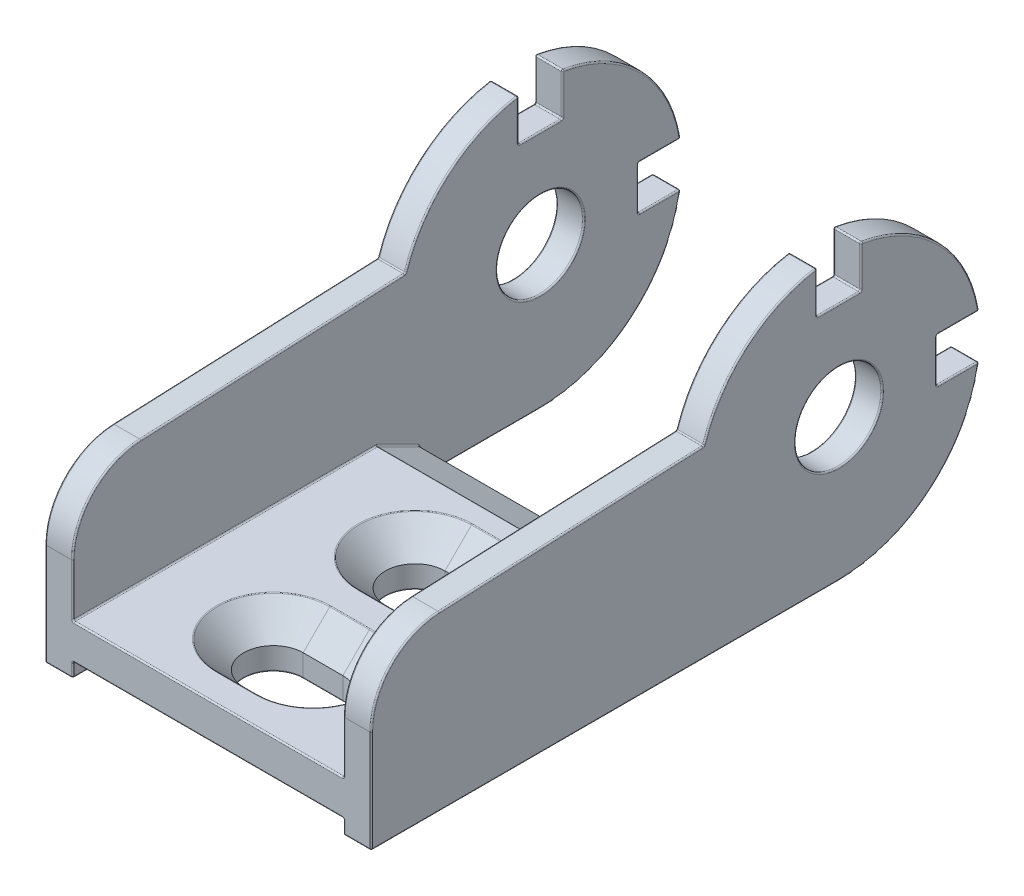
from build123d import *

# Parameters (mm, degrees)
BODY_DEPTH                       = 33
BODY_DEPTH_BACK                  = 10
PIVOT_HOLE_DEPTH                 = 37.349002737
PIVOT_HOLE_DEPTH_BACK            = 37.349002737
PIVOT_HOLE_SKETCH_R              = 3.05
OUTSIDE_SHAPE_CUT_OUT_DEPTH      = 37.349002737
OUTSIDE_SHAPE_CUT_OUT_DEPTH_BACK = 37.349002737
OUTSIDE_SHAPE_CUT_OUT_SKETCH_W   = 45
OUTSIDE_SHAPE_CUT_OUT_SKETCH_H   = 22
INSIDE_SHAPE_CUT_OUT_DEPTH       = 9.55
LIGHTENING_SKETCH_W              = 8
LIGHTENING_SKETCH_H              = 4
LIGHTENING_DEPTH                 = 0.5
M4_START                         = -10
M4_4_2X7_DEPTH                   = 3.5
F_15_15_BF_1PZ_W                 = 0.181818182
F_15_15_BF_1PZ_H                 = 0.285714286
F_15_15_BF_1PZ_W_2               = 0.181818181
TEXT_2_DEPTH                     = 0.05
PRODUCTION_FILLET_R              = 0.1


with BuildPart() as part:
    # Profile Sketch → Body (new, two sides: drawn at the far end of the back side and taken through both)
    with BuildSketch(Plane.XY.offset(-BODY_DEPTH_BACK)):
        Polygon((-11.5, -10), (11.5, -10), (11.5, 10), (9.55, 10), (9.55, -6.5), (-9.55, -6.5), (-9.55, 10), (-11.5, 10), align=None)
    extrude(amount=BODY_DEPTH + BODY_DEPTH_BACK)

    # Pivot Hole Sketch → Pivot Hole (cut, two sides: drawn at the far end of the back side and taken through both)
    with BuildSketch(Plane(origin=(0, 0, 0), x_dir=(0, 0, -1), z_dir=(1, 0, 0)).offset(-PIVOT_HOLE_DEPTH_BACK)):
        Circle(PIVOT_HOLE_SKETCH_R)
    extrude(amount=PIVOT_HOLE_DEPTH + PIVOT_HOLE_DEPTH_BACK, mode=Mode.SUBTRACT)

    # Outside Shape Cut Out Sketch → Outside Shape Cut Out (cut, two sides: drawn at the far end of the back side and taken through both)
    with BuildSketch(Plane(origin=(0, 0, 0), x_dir=(0, 0, -1), z_dir=(1, 0, 0)).offset(-OUTSIDE_SHAPE_CUT_OUT_DEPTH_BACK)):
        with Locations((-12.5, -1)):
            Rectangle(OUTSIDE_SHAPE_CUT_OUT_SKETCH_W, OUTSIDE_SHAPE_CUT_OUT_SKETCH_H)
        with BuildLine():
            Line((-28.212929862, 2.204047147), (-9.539392014, 3))
            ThreePointArc((-9.539392014, 3), (-6.524899368, 7.577973887), (-1.55, 9.8791447))
            Line((-1.55, 9.8791447), (-1.55, 6.9))
            Line((-1.55, 6.9), (1.55, 6.9))
            Line((1.55, 6.9), (1.55, 9.8791447))
            ThreePointArc((1.55, 9.8791447), (7.071067812, 7.071067812), (9.8791447, 1.55))
            Line((9.8791447, 1.55), (6.9, 1.55))
            Line((6.9, 1.55), (6.9, -1.55))
            Line((6.9, -1.55), (9.8791447, -1.55))
            ThreePointArc((9.8791447, -1.55), (6.5, -7.599342077), (0, -10))
            Line((0, -10), (-33, -10))
            Line((-33, -10), (-33, -2.791416882))
            ThreePointArc((-33, -2.791416882), (-31.610031116, 0.668015924), (-28.212929862, 2.204047147))
        make_face(mode=Mode.SUBTRACT)
    extrude(amount=OUTSIDE_SHAPE_CUT_OUT_DEPTH + OUTSIDE_SHAPE_CUT_OUT_DEPTH_BACK, mode=Mode.SUBTRACT)

    # Inside Shape Cut Out Sketch → Inside Shape Cut Out (cut, symmetric)
    with BuildSketch(Plane(origin=(0, 0, 0), x_dir=(0, 0, -1), z_dir=(1, 0, 0))):
        Polygon((-30, -8), (-30, -10), (-33, -10), (-33, -9), (-31.5, -9), (-31.5, -8), align=None)
        Polygon((-11.6, -6.5), (-8.6, -8), (-8.6, -10), (7.599342077, -10), (7.599342077, -6.5), align=None)
    extrude(amount=INSIDE_SHAPE_CUT_OUT_DEPTH, both=True, mode=Mode.SUBTRACT)

    # Lightening Sketch → Lightening (cut)
    with BuildSketch(Plane(origin=(0, -10, 0), x_dir=(1, 0, 0), z_dir=(0, 1, 0))):
        with Locations((0, -21.6)):
            Rectangle(LIGHTENING_SKETCH_W, LIGHTENING_SKETCH_H)
    extrude(amount=LIGHTENING_DEPTH, mode=Mode.SUBTRACT)

    # M4 4.2x7: read off the stored shape, not the designer's step
    # M4 4.2x7 outline → M4 4.2x7 (cut)
    with BuildSketch(Plane(origin=(0, 0, 0), x_dir=(1, 0, 0), z_dir=(0, 1, 0)).offset(M4_START)):
        with BuildLine():
            Line((-1.4, -19.1), (1.4, -19.1))
            ThreePointArc((1.4, -19.1), (3.5, -17), (1.4, -14.9))
            Line((1.4, -14.9), (-1.4, -14.9))
            ThreePointArc((-1.4, -14.9), (-3.5, -17), (-1.4, -19.1))
        make_face()
        with BuildLine():
            Line((-1.4, -29.1), (1.4, -29.1))
            ThreePointArc((1.4, -29.1), (3.5, -27), (1.4, -24.9))
            Line((1.4, -24.9), (-1.4, -24.9))
            ThreePointArc((-1.4, -24.9), (-3.5, -27), (-1.4, -29.1))
        make_face()
    extrude(amount=M4_4_2X7_DEPTH, mode=Mode.SUBTRACT)

    # M4 4.2x7 2: loft between two sections, ruled curve by curve
    m4_4_2x7_2_from = [
        Edge.make_three_point_arc((1.4, -8.4, 19.1), (2.88492424, -8.4, 18.48492424), (3.5, -8.4, 17)),
        Edge.make_three_point_arc((3.5, -8.4, 17), (2.88492424, -8.4, 15.51507576), (1.4, -8.4, 14.9)),
        Edge.make_three_point_arc((-1.4, -8.4, 14.9), (-2.88492424, -8.4, 15.51507576), (-3.5, -8.4, 17)),
        Edge.make_three_point_arc((-3.5, -8.4, 17), (-2.88492424, -8.4, 18.48492424), (-1.4, -8.4, 19.1)),
        Edge.make_line((1.4, -8.4, 14.9), (-1.4, -8.4, 14.9)),
        Edge.make_line((1.4, -8.4, 19.1), (-1.4, -8.4, 19.1)),
    ]
    m4_4_2x7_2_to = [
        Edge.make_three_point_arc((1.4, -6.5, 21), (4.228427125, -6.5, 19.828427125), (5.4, -6.5, 17)),
        Edge.make_three_point_arc((5.4, -6.5, 17), (4.228427125, -6.5, 14.171572875), (1.4, -6.5, 13)),
        Edge.make_three_point_arc((-1.4, -6.5, 13), (-4.228427125, -6.5, 14.171572875), (-5.4, -6.5, 17)),
        Edge.make_three_point_arc((-5.4, -6.5, 17), (-4.228427125, -6.5, 19.828427125), (-1.4, -6.5, 21)),
        Edge.make_line((1.4, -6.5, 13), (-1.4, -6.5, 13)),
        Edge.make_line((1.4, -6.5, 21), (-1.4, -6.5, 21)),
    ]
    m4_4_2x7_2 = Solid(Shell([*[Face.make_surface_from_curves(m4_4_2x7_2_from[k], m4_4_2x7_2_to[k]) for k in range(6)], Face(Wire(m4_4_2x7_2_from)), Face(Wire(m4_4_2x7_2_to))]))
    add(m4_4_2x7_2, mode=Mode.SUBTRACT)

    # M4 4.2x7 3: loft between two sections, ruled curve by curve
    m4_4_2x7_3_from = [
        Edge.make_three_point_arc((1.4, -8.4, 29.1), (2.88492424, -8.4, 28.48492424), (3.5, -8.4, 27)),
        Edge.make_three_point_arc((3.5, -8.4, 27), (2.88492424, -8.4, 25.51507576), (1.4, -8.4, 24.9)),
        Edge.make_three_point_arc((-1.4, -8.4, 24.9), (-2.88492424, -8.4, 25.51507576), (-3.5, -8.4, 27)),
        Edge.make_three_point_arc((-3.5, -8.4, 27), (-2.88492424, -8.4, 28.48492424), (-1.4, -8.4, 29.1)),
        Edge.make_line((1.4, -8.4, 24.9), (-1.4, -8.4, 24.9)),
        Edge.make_line((1.4, -8.4, 29.1), (-1.4, -8.4, 29.1)),
    ]
    m4_4_2x7_3_to = [
        Edge.make_three_point_arc((1.4, -6.5, 31), (4.228427125, -6.5, 29.828427125), (5.4, -6.5, 27)),
        Edge.make_three_point_arc((5.4, -6.5, 27), (4.228427125, -6.5, 24.171572875), (1.4, -6.5, 23)),
        Edge.make_three_point_arc((-1.4, -6.5, 23), (-4.228427125, -6.5, 24.171572875), (-5.4, -6.5, 27)),
        Edge.make_three_point_arc((-5.4, -6.5, 27), (-4.228427125, -6.5, 29.828427125), (-1.4, -6.5, 31)),
        Edge.make_line((1.4, -6.5, 23), (-1.4, -6.5, 23)),
        Edge.make_line((1.4, -6.5, 31), (-1.4, -6.5, 31)),
    ]
    m4_4_2x7_3 = Solid(Shell([*[Face.make_surface_from_curves(m4_4_2x7_3_from[k], m4_4_2x7_3_to[k]) for k in range(6)], Face(Wire(m4_4_2x7_3_from)), Face(Wire(m4_4_2x7_3_to))]))
    add(m4_4_2x7_3, mode=Mode.SUBTRACT)

    # 15.15.BF.1PZ → Text 2 (add)
    # profile 1 of 14: a face of its own
    with BuildSketch(Plane.ZY.offset(11.5)):
        with BuildLine():
            Line((30.227272727, -9), (30.227272727, -8.756493506))
            Line((30.227272727, -8.756493506), (31.039366883, -7.471996753))
            add(Edge.make_bspline(
                [(31.039366883, -7.471996753), (31.053137961, -7.450108749), (31.080078906, -7.40728832), (31.122272839, -7.346389293), (31.162540597, -7.288222528), (31.190472522, -7.251657499), (31.20413961, -7.233766234)],
                knots=[0, 0, 0, 0, 1.070761022, 2.094775167, 3.067773695, 4, 4, 4, 4], degree=3))
            Line((31.20413961, -7.233766234), (30.331168831, -7.233766234))
            Line((30.331168831, -7.233766234), (30.331168831, -7))
            Line((30.331168831, -7), (31.422077922, -7))
            Line((31.422077922, -7), (31.422077922, -7.233766234))
            Line((31.422077922, -7.233766234), (30.535308442, -8.625405844))
            Line((30.535308442, -8.625405844), (30.439123377, -8.766233766))
            Line((30.439123377, -8.766233766), (31.448051948, -8.766233766))
            Line((31.448051948, -8.766233766), (31.448051948, -9))
            Line((31.448051948, -9), (30.227272727, -9))
        make_face()
    # profile 2 of 14: a face of its own
    with BuildSketch(Plane.ZY.offset(11.5)):
        with BuildLine():
            Line((28.876623377, -9), (28.876623377, -7))
            Line((28.876623377, -7), (29.466720779, -7))
            add(Edge.make_bspline(
                [(29.466720779, -7), (29.483499496, -6.999986498), (29.515988494, -6.999960354), (29.56305899, -7.002350257), (29.606829948, -7.004738481), (29.6469886, -7.009453773), (29.683716496, -7.014566847), (29.717117649, -7.020902766), (29.747047725, -7.028950415), (29.765591459, -7.035473836), (29.774350649, -7.038555195)],
                knots=[0, 0, 0, 0, 1.292204597, 2.502124244, 3.629917638, 4.667912218, 5.615505495, 6.486114562, 7.284911457, 8, 8, 8, 8], degree=3))
            add(Edge.make_bspline(
                [(29.774350649, -7.038555195), (29.785414961, -7.043064461), (29.807647544, -7.052125363), (29.838974494, -7.069766716), (29.868923235, -7.089574807), (29.896623879, -7.11274038), (29.92310178, -7.138119323), (29.947460482, -7.166833355), (29.970261009, -7.198169278), (29.991124767, -7.232164222), (30.010519084, -7.268257931), (30.026426191, -7.30688291), (30.040459423, -7.34735033), (30.051632622, -7.389849385), (30.060639704, -7.434421915), (30.067108955, -7.480899713), (30.070750248, -7.529567384), (30.071198977, -7.562629219), (30.071428571, -7.579545455)],
                knots=[0, 0, 0, 0, 0.872141912, 1.752478363, 2.62147822, 3.49216273, 4.386863761, 5.298117704, 6.239170224, 7.215631144, 8.210428633, 9.229241514, 10.26384941, 11.337929136, 12.437003349, 13.584604597, 14.764152135, 16, 16, 16, 16], degree=3))
            add(Edge.make_bspline(
                [(30.071428571, -7.579545455), (30.071095411, -7.601749177), (30.070443827, -7.64517445), (30.06370393, -7.708638515), (30.0532709, -7.768878309), (30.03873399, -7.826107684), (30.019573855, -7.880097377), (29.996556116, -7.931225392), (29.96854898, -7.978799866), (29.937292394, -8.023853267), (29.900122044, -8.064377928), (29.856906878, -8.099765173), (29.80740286, -8.129492975), (29.751525125, -8.153208556), (29.689875444, -8.172485554), (29.621945066, -8.185512226), (29.547929151, -8.193132424), (29.496637058, -8.194232964), (29.469967532, -8.194805195)],
                knots=[0, 0, 0, 0, 1.07963488, 2.111512605, 3.100278053, 4.051458453, 4.979646617, 5.883635913, 6.774089034, 7.661400358, 8.546219573, 9.439294535, 10.369160486, 11.344634078, 12.38524447, 13.50536696, 14.702905748, 16, 16, 16, 16], degree=3))
            Line((29.469967532, -8.194805195), (29.058441558, -8.194805195))
            Line((29.058441558, -8.194805195), (29.058441558, -9))
            Line((29.058441558, -9), (28.876623377, -9))
        make_face()
        with BuildLine():
            Line((29.058441558, -7.961038961), (29.493506494, -7.961038961))
            add(Edge.make_bspline(
                [(29.493506494, -7.961038961), (29.510016983, -7.960668023), (29.542006231, -7.959949327), (29.58843729, -7.956115953), (29.631445945, -7.948804844), (29.671018267, -7.938792736), (29.707044093, -7.925736915), (29.739703143, -7.910037792), (29.768808948, -7.891142113), (29.794820012, -7.869544431), (29.816989345, -7.844450322), (29.836931648, -7.817115379), (29.85310437, -7.786248888), (29.866320883, -7.752583274), (29.877056347, -7.716228298), (29.884139683, -7.676901746), (29.888667282, -7.6347107), (29.889289774, -7.605531862), (29.88961039, -7.590503247)],
                knots=[0, 0, 0, 0, 1.269306236, 2.459294321, 3.577321076, 4.618943517, 5.592639886, 6.518111891, 7.397820391, 8.253919533, 9.107995395, 9.965041305, 10.848919063, 11.777714976, 12.741869721, 13.757527659, 14.845010431, 16, 16, 16, 16], degree=3))
            add(Edge.make_bspline(
                [(29.88961039, -7.590503247), (29.889148802, -7.570982186), (29.888255604, -7.533207812), (29.879016615, -7.478873146), (29.864724855, -7.428750684), (29.843807939, -7.383848641), (29.819345849, -7.344473941), (29.792560025, -7.310791733), (29.76264362, -7.284329417), (29.734801336, -7.267836134), (29.710349716, -7.257434167), (29.688559991, -7.25101503), (29.663399111, -7.245972964), (29.634957889, -7.241557676), (29.603291728, -7.237834722), (29.568340201, -7.235641252), (29.530050986, -7.233841271), (29.503384647, -7.233791989), (29.489448052, -7.233766234)],
                knots=[0, 0, 0, 0, 1.500314686, 2.903195123, 4.226916567, 5.498136997, 6.699407891, 7.786731959, 8.797026544, 9.75363827, 10.261964553, 10.838097333, 11.497334866, 12.234733717, 13.051831226, 13.948971176, 14.928073425, 16, 16, 16, 16], degree=3))
            Line((29.489448052, -7.233766234), (29.058441558, -7.233766234))
            Line((29.058441558, -7.233766234), (29.058441558, -7.961038961))
        make_face(mode=Mode.SUBTRACT)
    # profile 3 of 14: a face of its own
    with BuildSketch(Plane.ZY.offset(11.5)):
        with BuildLine():
            Line((28.279220779, -9), (28.097402597, -9))
            Line((28.097402597, -9), (28.097402597, -7.415584416))
            add(Edge.make_bspline(
                [(28.097402597, -7.415584416), (28.085451478, -7.430258881), (28.060746029, -7.460594053), (28.017703034, -7.503948602), (27.969779035, -7.548561616), (27.916693719, -7.591972318), (27.862562554, -7.633355453), (27.809170703, -7.670009137), (27.758326762, -7.701627434), (27.724148972, -7.718971991), (27.707792208, -7.727272727)],
                knots=[0, 0, 0, 0, 0.903640655, 1.868013201, 2.915356645, 4.030835779, 5.142488858, 6.169697721, 7.124056195, 8, 8, 8, 8], degree=3))
            Line((27.707792208, -7.727272727), (27.707792208, -7.493506494))
            add(Edge.make_bspline(
                [(27.707792208, -7.493506494), (27.733944664, -7.476632938), (27.786085812, -7.442991487), (27.858620187, -7.384667742), (27.927219003, -7.321842581), (27.989682434, -7.253793114), (28.045624156, -7.183687646), (28.093160439, -7.113372275), (28.132805987, -7.044424344), (28.151883626, -6.996990993), (28.16112013, -6.974025974)],
                knots=[0, 0, 0, 0, 1.065178085, 2.123686108, 3.182640109, 4.24814053, 5.283493564, 6.251038131, 7.153234134, 8, 8, 8, 8], degree=3))
            Line((28.16112013, -6.974025974), (28.279220779, -6.974025974))
            Line((28.279220779, -6.974025974), (28.279220779, -9))
        make_face()
    # profile 4 of 14: a face of its own
    with BuildSketch(Plane.ZY.offset(11.5)):
        with Locations((27.201298701, -8.857142857)):
            Rectangle(F_15_15_BF_1PZ_W, F_15_15_BF_1PZ_H)
    # profile 5 of 14: a face of its own
    with BuildSketch(Plane.ZY.offset(11.5)):
        Polygon((25.5, -7), (25.681818182, -7), (25.681818182, -8.652597403), (26.543425325, -7), (26.746753247, -7), (26.746753247, -9), (26.564935065, -9), (26.564935065, -7.345373377), (25.70211039, -9), (25.5, -9), align=None)
    # profile 6 of 14: a face of its own
    with BuildSketch(Plane.ZY.offset(11.5)):
        with Locations((25.045454546, -8.857142857)):
            Rectangle(F_15_15_BF_1PZ_W_2, F_15_15_BF_1PZ_H)
    # profile 7 of 14: a face of its own
    with BuildSketch(Plane.ZY.offset(11.5)):
        Polygon((23.577922078, -9), (23.577922078, -7), (24.616883117, -7), (24.616883117, -7.233766234), (23.75974026, -7.233766234), (23.75974026, -7.857142857), (24.512987013, -7.857142857), (24.512987013, -8.090909091), (23.75974026, -8.090909091), (23.75974026, -9), align=None)
    # profile 8 of 14: a face of its own
    with BuildSketch(Plane.ZY.offset(11.5)):
        with BuildLine():
            Line((22.123376623, -9), (22.123376623, -7))
            Line((22.123376623, -7), (22.715909091, -7))
            add(Edge.make_bspline(
                [(22.715909091, -7), (22.744352685, -7.000668288), (22.798478853, -7.001939993), (22.875048652, -7.012251206), (22.942533423, -7.029706901), (23.001230104, -7.055357369), (23.05278655, -7.088638618), (23.098696222, -7.129793932), (23.139366483, -7.179084961), (23.174799895, -7.235266455), (23.203902156, -7.296956405), (23.225055337, -7.362668407), (23.238149977, -7.431703655), (23.239547858, -7.478837566), (23.24025974, -7.502840909)],
                knots=[0, 0, 0, 0, 1.24334782, 2.366003869, 3.370416698, 4.281541728, 5.154440576, 6.042598826, 6.966594164, 7.939742136, 8.939983312, 9.940784044, 10.951326851, 12, 12, 12, 12], degree=3))
            add(Edge.make_bspline(
                [(23.24025974, -7.502840909), (23.239660072, -7.52492828), (23.238484064, -7.568243715), (23.228550318, -7.631426919), (23.212226246, -7.69132856), (23.189677664, -7.747481789), (23.161235419, -7.799318751), (23.127277683, -7.845929332), (23.08821855, -7.887620352), (23.058112569, -7.910571686), (23.043019481, -7.922077922)],
                knots=[0, 0, 0, 0, 1.100128987, 2.157457499, 3.17793391, 4.188138721, 5.165697486, 6.116294314, 7.055638233, 8, 8, 8, 8], degree=3))
            add(Edge.make_bspline(
                [(23.043019481, -7.922077922), (23.061703341, -7.931693983), (23.099148747, -7.950966086), (23.148158769, -7.992278552), (23.191007865, -8.0423901), (23.227340587, -8.101401999), (23.256543287, -8.168758972), (23.277502593, -8.243683347), (23.290199126, -8.325866148), (23.2915217, -8.383069168), (23.292207792, -8.412743506)],
                knots=[0, 0, 0, 0, 0.864537384, 1.732669384, 2.623043898, 3.575405937, 4.580026179, 5.641676268, 6.776608354, 8, 8, 8, 8], degree=3))
            add(Edge.make_bspline(
                [(23.292207792, -8.412743506), (23.291374201, -8.442555473), (23.289755428, -8.500448098), (23.276524827, -8.584503723), (23.254782572, -8.66297334), (23.224003322, -8.735068498), (23.186039284, -8.799588858), (23.141994088, -8.855706501), (23.091644937, -8.902131472), (23.044541632, -8.932904899), (23.003612537, -8.952309108), (22.970379483, -8.965497575), (22.933971657, -8.975729019), (22.895133945, -8.9847278), (22.853516912, -8.991614453), (22.809195505, -8.996237582), (22.762097108, -8.999804141), (22.729715217, -8.999933499), (22.713068182, -9)],
                knots=[0, 0, 0, 0, 1.516322695, 2.944586063, 4.317550073, 5.649876524, 6.921364277, 8.116844601, 9.266620758, 10.391228453, 10.963907361, 11.569836126, 12.208099946, 12.886073308, 13.597903734, 14.352768763, 15.153183562, 16, 16, 16, 16], degree=3))
            Line((22.713068182, -9), (22.123376623, -9))
        make_face()
        with BuildLine():
            Line((22.305194805, -7.831168831), (22.672077922, -7.831168831))
            add(Edge.make_bspline(
                [(22.672077922, -7.831168831), (22.694276432, -7.831008276), (22.735325777, -7.830711378), (22.791610365, -7.826842112), (22.838006041, -7.822275999), (22.864772365, -7.815218793), (22.876623377, -7.812094156)],
                knots=[0, 0, 0, 0, 1.292436319, 2.38996507, 3.287143691, 4, 4, 4, 4], degree=3))
            add(Edge.make_bspline(
                [(22.876623377, -7.812094156), (22.890499868, -7.807151106), (22.917608197, -7.797494644), (22.953915888, -7.775392673), (22.985782883, -7.749360442), (23.012332083, -7.717807064), (23.033306365, -7.680566984), (23.048150255, -7.637423402), (23.057138878, -7.588438862), (23.057992649, -7.553883404), (23.058441558, -7.535714286)],
                knots=[0, 0, 0, 0, 0.985692061, 1.925592202, 2.834090346, 3.735629155, 4.674258301, 5.684412328, 6.782473517, 8, 8, 8, 8], degree=3))
            add(Edge.make_bspline(
                [(23.058441558, -7.535714286), (23.05786144, -7.518643586), (23.056750031, -7.48593903), (23.049268008, -7.438837135), (23.035395389, -7.396522829), (23.016552989, -7.35870101), (22.993557196, -7.325731429), (22.966482946, -7.298017499), (22.935468319, -7.276156829), (22.90651397, -7.262556719), (22.880586075, -7.25374253), (22.857223589, -7.248901638), (22.830638426, -7.243768684), (22.800350096, -7.240531992), (22.76670545, -7.236980698), (22.72931601, -7.235244271), (22.688456582, -7.233961799), (22.660039301, -7.233833049), (22.645292208, -7.233766234)],
                knots=[0, 0, 0, 0, 1.375164284, 2.634580633, 3.826915429, 4.947791758, 6.027109627, 7.051967833, 8.052731805, 9.066581296, 9.617940777, 10.25503093, 10.986037232, 11.798372039, 12.707031135, 13.711052907, 14.812155372, 16, 16, 16, 16], degree=3))
            Line((22.645292208, -7.233766234), (22.305194805, -7.233766234))
            Line((22.305194805, -7.233766234), (22.305194805, -7.831168831))
        make_face(mode=Mode.SUBTRACT)
        with BuildLine():
            Line((22.305194805, -8.766233766), (22.717532468, -8.766233766))
            add(Edge.make_bspline(
                [(22.717532468, -8.766233766), (22.738789416, -8.76599889), (22.778390748, -8.765561318), (22.8332439, -8.76051487), (22.879601309, -8.753818876), (22.906599261, -8.745046095), (22.918831169, -8.741071429)],
                knots=[0, 0, 0, 0, 1.251176501, 2.330920443, 3.243793485, 4, 4, 4, 4], degree=3))
            add(Edge.make_bspline(
                [(22.918831169, -8.741071429), (22.933858902, -8.734558664), (22.963178721, -8.721851951), (23.00188753, -8.694166681), (23.035420024, -8.661428158), (23.062737288, -8.622212702), (23.084217084, -8.577666455), (23.099804527, -8.527801725), (23.108453784, -8.472703032), (23.109728717, -8.434282901), (23.11038961, -8.414366883)],
                knots=[0, 0, 0, 0, 0.968327408, 1.889252548, 2.802079097, 3.734175785, 4.705982523, 5.72288555, 6.819601842, 8, 8, 8, 8], degree=3))
            add(Edge.make_bspline(
                [(23.11038961, -8.414366883), (23.109929201, -8.395791091), (23.109039502, -8.359895125), (23.09981683, -8.3083698), (23.085465565, -8.261075979), (23.064560821, -8.218676582), (23.03887363, -8.181340424), (23.009576072, -8.148508821), (22.975270461, -8.122047601), (22.943598267, -8.104044103), (22.915318753, -8.092859608), (22.891306861, -8.084897832), (22.864137561, -8.079304008), (22.834414237, -8.073820338), (22.801884915, -8.069857325), (22.766534394, -8.067223406), (22.728384111, -8.064908203), (22.701979126, -8.064925903), (22.688311688, -8.064935065)],
                knots=[0, 0, 0, 0, 1.410852607, 2.726339613, 3.965687343, 5.156991405, 6.303778718, 7.403095904, 8.487347597, 9.583195376, 10.159968796, 10.797459114, 11.503597307, 12.266198149, 13.095383443, 13.993050727, 14.96118653, 16, 16, 16, 16], degree=3))
            Line((22.688311688, -8.064935065), (22.305194805, -8.064935065))
            Line((22.305194805, -8.064935065), (22.305194805, -8.766233766))
        make_face(mode=Mode.SUBTRACT)
    # profile 9 of 14: a face of its own
    with BuildSketch(Plane.ZY.offset(11.5)):
        with Locations((21.668831169, -8.857142857)):
            Rectangle(F_15_15_BF_1PZ_W, F_15_15_BF_1PZ_H)
    # profile 10 of 14: a face of its own
    with BuildSketch(Plane.ZY.offset(11.5)):
        with BuildLine():
            Line((20.227272727, -8.454545455), (20.409090909, -8.428571429))
            add(Edge.make_bspline(
                [(20.409090909, -8.428571429), (20.411335365, -8.444432924), (20.415710559, -8.475352271), (20.425252751, -8.519851789), (20.435812817, -8.561528413), (20.449532551, -8.599719521), (20.464270703, -8.63517906), (20.481377669, -8.667382423), (20.500409471, -8.696448489), (20.521738118, -8.721942922), (20.543935753, -8.744839394), (20.567513301, -8.764396462), (20.592190727, -8.780632121), (20.617232749, -8.794671126), (20.64340506, -8.805309038), (20.670545205, -8.812592617), (20.698573428, -8.817181051), (20.717650307, -8.817846277), (20.727272727, -8.818181818)],
                knots=[0, 0, 0, 0, 1.390810186, 2.711153235, 3.950829843, 5.121319443, 6.232085185, 7.283279419, 8.283673941, 9.243434424, 10.165640344, 11.050179826, 11.897414992, 12.728197423, 13.53981701, 14.343574861, 15.164495528, 16, 16, 16, 16], degree=3))
            add(Edge.make_bspline(
                [(20.727272727, -8.818181818), (20.739203712, -8.817794854), (20.762951491, -8.817024629), (20.797839315, -8.810756918), (20.831607855, -8.800661357), (20.863687976, -8.78571896), (20.894780647, -8.767374184), (20.924684035, -8.745005911), (20.952451231, -8.71769586), (20.979770224, -8.687654473), (21.004432305, -8.653533064), (21.026038688, -8.616179427), (21.043682815, -8.575583179), (21.059067867, -8.532455942), (21.069978795, -8.485970624), (21.078747997, -8.436833258), (21.08351136, -8.384563718), (21.084108536, -8.348764108), (21.084415584, -8.330357143)],
                knots=[0, 0, 0, 0, 0.849985469, 1.691835867, 2.518526591, 3.355724622, 4.207458809, 5.088865162, 6.009643127, 6.979461518, 7.980562488, 9.004441626, 10.04917987, 11.131860497, 12.263879062, 13.448170008, 14.687934212, 16, 16, 16, 16], degree=3))
            add(Edge.make_bspline(
                [(21.084415584, -8.330357143), (21.084070601, -8.313169159), (21.083398446, -8.279680554), (21.079145523, -8.230789511), (21.070934679, -8.184969208), (21.059954822, -8.142101809), (21.046376491, -8.101943801), (21.0287881, -8.065089168), (21.008439286, -8.030970912), (20.984852679, -8.000216657), (20.959095091, -7.9728113), (20.931513756, -7.948821029), (20.902336794, -7.928670124), (20.871679041, -7.911508934), (20.83897195, -7.89932139), (20.805004933, -7.889524559), (20.76922255, -7.884499542), (20.744871672, -7.883581478), (20.732548701, -7.883116883)],
                knots=[0, 0, 0, 0, 1.290991288, 2.515332729, 3.681284767, 4.782816797, 5.836743535, 6.859351119, 7.84384712, 8.815200789, 9.763974252, 10.66434647, 11.554977793, 12.423426395, 13.295137735, 14.170217621, 15.074022892, 16, 16, 16, 16], degree=3))
            add(Edge.make_bspline(
                [(20.732548701, -7.883116883), (20.717481141, -7.883733919), (20.687566621, -7.884958958), (20.643430592, -7.895088315), (20.601089966, -7.912005663), (20.560516519, -7.93472706), (20.522677932, -7.963101666), (20.488803116, -7.997210423), (20.458801577, -8.03626392), (20.443061233, -8.065503207), (20.435064935, -8.080357143)],
                knots=[0, 0, 0, 0, 0.961178176, 1.908283851, 2.873798308, 3.863689513, 4.869021539, 5.882813834, 6.924442106, 8, 8, 8, 8], degree=3))
            Line((20.435064935, -8.080357143), (20.253246753, -8.050730519))
            Line((20.253246753, -8.050730519), (20.409090909, -7.025974026))
            Line((20.409090909, -7.025974026), (21.214285714, -7.025974026))
            Line((21.214285714, -7.025974026), (21.214285714, -7.25974026))
            Line((21.214285714, -7.25974026), (20.557224026, -7.25974026))
            Line((20.557224026, -7.25974026), (20.479301948, -7.773538961))
            add(Edge.make_bspline(
                [(20.479301948, -7.773538961), (20.490961885, -7.765656695), (20.513913246, -7.750141283), (20.549840012, -7.730082649), (20.586568506, -7.713712288), (20.623303627, -7.699058876), (20.660944808, -7.688768312), (20.698856272, -7.680807728), (20.737449174, -7.676378713), (20.763382745, -7.675676569), (20.77637987, -7.675324675)],
                knots=[0, 0, 0, 0, 1.062173359, 2.090776726, 3.10075852, 4.096440898, 5.072767255, 6.042125507, 7.018772268, 8, 8, 8, 8], degree=3))
            add(Edge.make_bspline(
                [(20.77637987, -7.675324675), (20.792648906, -7.675884224), (20.824849631, -7.676991719), (20.872235402, -7.685430409), (20.918085505, -7.698755652), (20.962238468, -7.718044166), (21.004390706, -7.74299342), (21.045077183, -7.773014148), (21.084061038, -7.8085242), (21.12113168, -7.849203695), (21.155023172, -7.894626918), (21.18554515, -7.943717443), (21.209891305, -7.9974611), (21.230954561, -8.054299043), (21.246414851, -8.115313232), (21.258496898, -8.179781217), (21.264648299, -8.248257772), (21.265696847, -8.29503884), (21.266233766, -8.318993506)],
                knots=[0, 0, 0, 0, 0.866704079, 1.715436676, 2.557311772, 3.406564867, 4.275904221, 5.162797593, 6.096938988, 7.082006378, 8.091445148, 9.114110525, 10.156039201, 11.230370463, 12.34089356, 13.506240279, 14.723047946, 16, 16, 16, 16], degree=3))
            add(Edge.make_bspline(
                [(21.266233766, -8.318993506), (21.265701245, -8.342814967), (21.264652382, -8.389734061), (21.258305231, -8.458820049), (21.246776578, -8.525239109), (21.2311392, -8.589249292), (21.210231458, -8.650445114), (21.185553958, -8.709388787), (21.155804551, -8.765394421), (21.121956341, -8.818256265), (21.084686987, -8.866931221), (21.04349376, -8.909520917), (20.999021691, -8.945439052), (20.951457029, -8.975211789), (20.900546731, -8.997810037), (20.846617728, -9.014292851), (20.789595271, -9.024177912), (20.750444897, -9.025368222), (20.730519481, -9.025974026)],
                knots=[0, 0, 0, 0, 1.155655988, 2.276196744, 3.361537643, 4.42314898, 5.469066992, 6.495345604, 7.519860272, 8.54109096, 9.537390043, 10.488759157, 11.40808299, 12.304038904, 13.202898125, 14.101757346, 15.033897509, 16, 16, 16, 16], degree=3))
            add(Edge.make_bspline(
                [(20.730519481, -9.025974026), (20.713856667, -9.025486039), (20.681062531, -9.02452563), (20.63288238, -9.017530833), (20.586727006, -9.005777562), (20.542527241, -8.988933583), (20.500342538, -8.967443386), (20.460129572, -8.941106255), (20.42202778, -8.910140873), (20.385839304, -8.874849789), (20.352640263, -8.835256138), (20.323347727, -8.791467248), (20.297742113, -8.744160625), (20.275709143, -8.693286601), (20.25806358, -8.638711478), (20.243797091, -8.580672862), (20.233206782, -8.518955217), (20.229282557, -8.476360664), (20.227272727, -8.454545455)],
                knots=[0, 0, 0, 0, 0.946382655, 1.862578763, 2.759128995, 3.646907966, 4.54395212, 5.443461814, 6.372429049, 7.328898874, 8.310900169, 9.302030709, 10.316483773, 11.362918494, 12.446807447, 13.570741436, 14.755831862, 16, 16, 16, 16], degree=3))
        make_face()
    # profile 11 of 14: a face of its own
    with BuildSketch(Plane.ZY.offset(11.5)):
        with BuildLine():
            Line((19.707792208, -9), (19.525974026, -9))
            Line((19.525974026, -9), (19.525974026, -7.415584416))
            add(Edge.make_bspline(
                [(19.525974026, -7.415584416), (19.514022907, -7.430258881), (19.489317458, -7.460594053), (19.446274462, -7.503948602), (19.398350464, -7.548561616), (19.345265148, -7.591972318), (19.291133982, -7.633355453), (19.237742132, -7.670009137), (19.18689819, -7.701627434), (19.152720401, -7.718971991), (19.136363636, -7.727272727)],
                knots=[0, 0, 0, 0, 0.903640655, 1.868013201, 2.915356645, 4.030835779, 5.142488858, 6.169697721, 7.124056195, 8, 8, 8, 8], degree=3))
            Line((19.136363636, -7.727272727), (19.136363636, -7.493506494))
            add(Edge.make_bspline(
                [(19.136363636, -7.493506494), (19.162516092, -7.476632938), (19.21465724, -7.442991487), (19.287191615, -7.384667742), (19.355790432, -7.321842581), (19.418253863, -7.253793114), (19.474195584, -7.183687646), (19.521731868, -7.113372275), (19.561377415, -7.044424344), (19.580455054, -6.996990993), (19.589691558, -6.974025974)],
                knots=[0, 0, 0, 0, 1.065178085, 2.123686108, 3.182640109, 4.24814053, 5.283493564, 6.251038131, 7.153234134, 8, 8, 8, 8], degree=3))
            Line((19.589691558, -6.974025974), (19.707792208, -6.974025974))
            Line((19.707792208, -6.974025974), (19.707792208, -9))
        make_face()
    # profile 12 of 14: a face of its own
    with BuildSketch(Plane.ZY.offset(11.5)):
        with Locations((18.62987013, -8.857142857)):
            Rectangle(F_15_15_BF_1PZ_W, F_15_15_BF_1PZ_H)
    # profile 13 of 14: a face of its own
    with BuildSketch(Plane.ZY.offset(11.5)):
        with BuildLine():
            Line((17.188311688, -8.454545455), (17.37012987, -8.428571429))
            add(Edge.make_bspline(
                [(17.37012987, -8.428571429), (17.372374326, -8.444432924), (17.37674952, -8.475352271), (17.386291712, -8.519851789), (17.396851778, -8.561528413), (17.410571512, -8.599719521), (17.425309664, -8.63517906), (17.44241663, -8.667382423), (17.461448432, -8.696448489), (17.482777079, -8.721942922), (17.504974714, -8.744839394), (17.528552262, -8.764396462), (17.553229688, -8.780632121), (17.57827171, -8.794671126), (17.604444021, -8.805309038), (17.631584166, -8.812592617), (17.659612389, -8.817181051), (17.678689269, -8.817846277), (17.688311688, -8.818181818)],
                knots=[0, 0, 0, 0, 1.390810186, 2.711153235, 3.950829843, 5.121319443, 6.232085185, 7.283279419, 8.283673941, 9.243434424, 10.165640344, 11.050179826, 11.897414992, 12.728197423, 13.53981701, 14.343574861, 15.164495528, 16, 16, 16, 16], degree=3))
            add(Edge.make_bspline(
                [(17.688311688, -8.818181818), (17.700242673, -8.817794854), (17.723990453, -8.817024629), (17.758878276, -8.810756918), (17.792646816, -8.800661357), (17.824726937, -8.78571896), (17.855819608, -8.767374184), (17.885722996, -8.745005911), (17.913490192, -8.71769586), (17.940809185, -8.687654473), (17.965471266, -8.653533064), (17.987077649, -8.616179427), (18.004721776, -8.575583179), (18.020106828, -8.532455942), (18.031017756, -8.485970624), (18.039786958, -8.436833258), (18.044550321, -8.384563718), (18.045147497, -8.348764108), (18.045454545, -8.330357143)],
                knots=[0, 0, 0, 0, 0.849985469, 1.691835867, 2.518526591, 3.355724622, 4.207458809, 5.088865162, 6.009643127, 6.979461518, 7.980562488, 9.004441626, 10.04917987, 11.131860497, 12.263879062, 13.448170008, 14.687934212, 16, 16, 16, 16], degree=3))
            add(Edge.make_bspline(
                [(18.045454545, -8.330357143), (18.045109562, -8.313169159), (18.044437407, -8.279680554), (18.040184484, -8.230789511), (18.03197364, -8.184969208), (18.020993783, -8.142101809), (18.007415452, -8.101943801), (17.989827061, -8.065089168), (17.969478247, -8.030970912), (17.94589164, -8.000216657), (17.920134052, -7.9728113), (17.892552717, -7.948821029), (17.863375755, -7.928670124), (17.832718002, -7.911508934), (17.800010911, -7.89932139), (17.766043894, -7.889524559), (17.730261511, -7.884499542), (17.705910633, -7.883581478), (17.693587662, -7.883116883)],
                knots=[0, 0, 0, 0, 1.290991288, 2.515332729, 3.681284767, 4.782816797, 5.836743535, 6.859351119, 7.84384712, 8.815200789, 9.763974252, 10.66434647, 11.554977793, 12.423426395, 13.295137735, 14.170217621, 15.074022892, 16, 16, 16, 16], degree=3))
            add(Edge.make_bspline(
                [(17.693587662, -7.883116883), (17.678520102, -7.883733919), (17.648605582, -7.884958958), (17.604469553, -7.895088315), (17.562128927, -7.912005663), (17.52155548, -7.93472706), (17.483716893, -7.963101666), (17.449842077, -7.997210423), (17.419840538, -8.03626392), (17.404100194, -8.065503207), (17.396103896, -8.080357143)],
                knots=[0, 0, 0, 0, 0.961178176, 1.908283851, 2.873798308, 3.863689513, 4.869021539, 5.882813834, 6.924442106, 8, 8, 8, 8], degree=3))
            Line((17.396103896, -8.080357143), (17.214285714, -8.050730519))
            Line((17.214285714, -8.050730519), (17.37012987, -7.025974026))
            Line((17.37012987, -7.025974026), (18.175324675, -7.025974026))
            Line((18.175324675, -7.025974026), (18.175324675, -7.25974026))
            Line((18.175324675, -7.25974026), (17.518262987, -7.25974026))
            Line((17.518262987, -7.25974026), (17.440340909, -7.773538961))
            add(Edge.make_bspline(
                [(17.440340909, -7.773538961), (17.452000846, -7.765656695), (17.474952207, -7.750141283), (17.510878973, -7.730082649), (17.547607467, -7.713712288), (17.584342588, -7.699058876), (17.621983769, -7.688768312), (17.659895233, -7.680807728), (17.698488135, -7.676378713), (17.724421706, -7.675676569), (17.737418831, -7.675324675)],
                knots=[0, 0, 0, 0, 1.062173359, 2.090776726, 3.10075852, 4.096440898, 5.072767255, 6.042125507, 7.018772268, 8, 8, 8, 8], degree=3))
            add(Edge.make_bspline(
                [(17.737418831, -7.675324675), (17.753687867, -7.675884224), (17.785888592, -7.676991719), (17.833274363, -7.685430409), (17.879124466, -7.698755652), (17.923277429, -7.718044166), (17.965429667, -7.74299342), (18.006116144, -7.773014148), (18.0451, -7.8085242), (18.082170641, -7.849203695), (18.116062133, -7.894626918), (18.146584111, -7.943717443), (18.170930266, -7.9974611), (18.191993523, -8.054299043), (18.207453812, -8.115313232), (18.219535859, -8.179781217), (18.22568726, -8.248257772), (18.226735808, -8.29503884), (18.227272727, -8.318993506)],
                knots=[0, 0, 0, 0, 0.866704079, 1.715436676, 2.557311772, 3.406564867, 4.275904221, 5.162797593, 6.096938988, 7.082006378, 8.091445148, 9.114110525, 10.156039201, 11.230370463, 12.34089356, 13.506240279, 14.723047946, 16, 16, 16, 16], degree=3))
            add(Edge.make_bspline(
                [(18.227272727, -8.318993506), (18.226740206, -8.342814967), (18.225691343, -8.389734061), (18.219344192, -8.458820049), (18.207815539, -8.525239109), (18.192178161, -8.589249292), (18.171270419, -8.650445114), (18.146592919, -8.709388787), (18.116843512, -8.765394421), (18.082995302, -8.818256265), (18.045725948, -8.866931221), (18.004532721, -8.909520917), (17.960060652, -8.945439052), (17.91249599, -8.975211789), (17.861585692, -8.997810037), (17.807656689, -9.014292851), (17.750634232, -9.024177912), (17.711483858, -9.025368222), (17.691558442, -9.025974026)],
                knots=[0, 0, 0, 0, 1.155655988, 2.276196744, 3.361537643, 4.42314898, 5.469066992, 6.495345604, 7.519860272, 8.54109096, 9.537390043, 10.488759157, 11.40808299, 12.304038904, 13.202898125, 14.101757346, 15.033897509, 16, 16, 16, 16], degree=3))
            add(Edge.make_bspline(
                [(17.691558442, -9.025974026), (17.674895628, -9.025486039), (17.642101492, -9.02452563), (17.593921341, -9.017530833), (17.547765967, -9.005777562), (17.503566202, -8.988933583), (17.461381499, -8.967443386), (17.421168533, -8.941106255), (17.383066741, -8.910140873), (17.346878265, -8.874849789), (17.313679224, -8.835256138), (17.284386688, -8.791467248), (17.258781074, -8.744160625), (17.236748104, -8.693286601), (17.219102541, -8.638711478), (17.204836052, -8.580672862), (17.194245743, -8.518955217), (17.190321518, -8.476360664), (17.188311688, -8.454545455)],
                knots=[0, 0, 0, 0, 0.946382655, 1.862578763, 2.759128995, 3.646907966, 4.54395212, 5.443461814, 6.372429049, 7.328898874, 8.310900169, 9.302030709, 10.316483773, 11.362918494, 12.446807447, 13.570741436, 14.755831862, 16, 16, 16, 16], degree=3))
        make_face()
    # profile 14 of 14: a face of its own
    with BuildSketch(Plane.ZY.offset(11.5)):
        with BuildLine():
            Line((16.668831169, -9), (16.487012987, -9))
            Line((16.487012987, -9), (16.487012987, -7.415584416))
            add(Edge.make_bspline(
                [(16.487012987, -7.415584416), (16.475061868, -7.430258881), (16.450356419, -7.460594053), (16.407313424, -7.503948602), (16.359389425, -7.548561616), (16.306304109, -7.591972318), (16.252172943, -7.633355453), (16.198781093, -7.670009137), (16.147937151, -7.701627434), (16.113759362, -7.718971991), (16.097402597, -7.727272727)],
                knots=[0, 0, 0, 0, 0.903640655, 1.868013201, 2.915356645, 4.030835779, 5.142488858, 6.169697721, 7.124056195, 8, 8, 8, 8], degree=3))
            Line((16.097402597, -7.727272727), (16.097402597, -7.493506494))
            add(Edge.make_bspline(
                [(16.097402597, -7.493506494), (16.123555054, -7.476632938), (16.175696201, -7.442991487), (16.248230576, -7.384667742), (16.316829393, -7.321842581), (16.379292824, -7.253793114), (16.435234546, -7.183687646), (16.482770829, -7.113372275), (16.522416376, -7.044424344), (16.541494015, -6.996990993), (16.550730519, -6.974025974)],
                knots=[0, 0, 0, 0, 1.065178085, 2.123686108, 3.182640109, 4.24814053, 5.283493564, 6.251038131, 7.153234134, 8, 8, 8, 8], degree=3))
            Line((16.550730519, -6.974025974), (16.668831169, -6.974025974))
            Line((16.668831169, -6.974025974), (16.668831169, -9))
        make_face()
    extrude(amount=TEXT_2_DEPTH)

    # Production Fillet
    production_fillet_edges = [part.edges().sort_by_distance(p)[0] for p in [
        (10.525, -10, 33),
        (9.55, -6.5, 22.3),
        (-9.55, -6.5, 22.3),
        (-9.55, -8, 30.75),
        (0, -8, 31.5),
        (-9.55, -9, 30),
        (0, -8, 30),
        (-9.55, -10, 31.5),
        (0, -10, 30),
        (-9.55, -9.5, 33),
        (-9.55, -9, 32.25),
        (0, -9, 33),
        (-9.55, -8.5, 31.5),
        (0, -9, 31.5),
        (9.55, -8, 30.75),
        (9.55, -8.5, 31.5),
        (9.55, -9, 32.25),
        (9.55, -9.5, 33),
        (9.55, -10, 31.5),
        (9.55, -9, 30),
        (0, -6.5, 11.6),
        (-9.55, -10, 4.3),
        (-9.55, -9, 8.6),
        (0, -10, 8.6),
        (-9.55, -7.25, 10.1),
        (0, -8, 8.6),
        (9.55, -7.25, 10.1),
        (9.55, -9, 8.6),
        (9.55, -10, 4.3),
        (4, -10, 21.6),
        (0, -10, 19.6),
        (-4, -10, 21.6),
        (0, -10, 23.6),
        (4, -9.5, 21.6),
        (0, -9.5, 19.6),
        (-4, -9.5, 21.6),
        (0, -9.5, 23.6),
        (0, -6.5, 21),
        (4.228427125, -6.5, 19.828427125),
        (-4.228427125, -6.5, 14.171572875),
        (0, -10, 14.9),
        (3.5, -10, 17),
        (-3.5, -10, 17),
        (0, -6.5, 13),
        (0, -10, 19.1),
        (0, -6.5, 31),
        (4.228427125, -6.5, 24.171572875),
        (-4.228427125, -6.5, 24.171572875),
        (0, -10, 24.9),
        (3.5, -10, 27),
        (-3.5, -10, 27),
        (0, -6.5, 23),
        (0, -10, 29.1),
        (11.5, -6.395708441, 33),
        (0, -6.5, 33),
        (-9.55, -4.645708441, 33),
        (-10.525, -10, 33),
        (9.55, 0, 3.05),
        (-9.55, 0, 3.05),
        (-11.5, 0, 3.05),
        (11.5, 0, 3.05),
        (9.55, -4.645708441, 33),
        (-11.5, -6.395708441, 33),
        (9.55, -1.55, -8.38957235),
        (9.55, 0, -6.9),
        (9.55, 1.55, -8.38957235),
        (9.55, 7.071067812, -7.071067812),
        (9.55, 8.38957235, -1.55),
        (9.55, 6.9, 0),
        (9.55, 8.38957235, 1.55),
        (9.55, 7.577973887, 6.524899368),
        (9.55, 2.602023574, 18.876160938),
        (9.55, -7.599342077, -6.5),
        (-11.5, -10, 16.5),
        (11.5, -10, 16.5),
        (-10.525, 3, 9.539392014),
        (-9.55, 2.602023574, 18.876160938),
        (-10.525, 9.8791447, 1.55),
        (-9.55, 7.577973887, 6.524899368),
        (-10.525, 6.9, 1.55),
        (-9.55, 8.38957235, 1.55),
        (-10.525, 6.9, -1.55),
        (-9.55, 6.9, 0),
        (-10.525, 9.8791447, -1.55),
        (-9.55, 8.38957235, -1.55),
        (-10.525, 1.55, -9.8791447),
        (-9.55, 7.071067812, -7.071067812),
        (-10.525, 1.55, -6.9),
        (-9.55, 1.55, -8.38957235),
        (-10.525, -1.55, -6.9),
        (-9.55, 0, -6.9),
        (-10.525, -1.55, -9.8791447),
        (-9.55, -1.55, -8.38957235),
        (-9.55, 0.668015924, 31.610031116),
        (-11.5, -7.599342077, -6.5),
        (-11.5, -1.55, -8.38957235),
        (-11.5, 0, -6.9),
        (-11.5, 1.55, -8.38957235),
        (-11.5, 7.071067812, -7.071067812),
        (-11.5, 8.38957235, -1.55),
        (-11.5, 6.9, 0),
        (-11.5, 8.38957235, 1.55),
        (-11.5, 7.577973887, 6.524899368),
        (-11.5, 2.602023574, 18.876160938),
        (-11.5, 0.668015924, 31.610031116),
        (-9.55, -7.599342077, -6.5),
        (11.5, -7.599342077, -6.5),
        (9.55, 0.668015924, 31.610031116),
        (11.5, 0.668015924, 31.610031116),
        (10.525, 3, 9.539392014),
        (11.5, 2.602023574, 18.876160938),
        (10.525, 9.8791447, 1.55),
        (11.5, 7.577973887, 6.524899368),
        (10.525, 6.9, 1.55),
        (11.5, 8.38957235, 1.55),
        (10.525, 6.9, -1.55),
        (11.5, 6.9, 0),
        (10.525, 9.8791447, -1.55),
        (11.5, 8.38957235, -1.55),
        (10.525, 1.55, -9.8791447),
        (11.5, 7.071067812, -7.071067812),
        (10.525, 1.55, -6.9),
        (11.5, 1.55, -8.38957235),
        (10.525, -1.55, -6.9),
        (11.5, 0, -6.9),
        (10.525, -1.55, -9.8791447),
        (11.5, -1.55, -8.38957235),
    ]]
    fillet(production_fillet_edges, radius=PRODUCTION_FILLET_R)


solid = part.part
